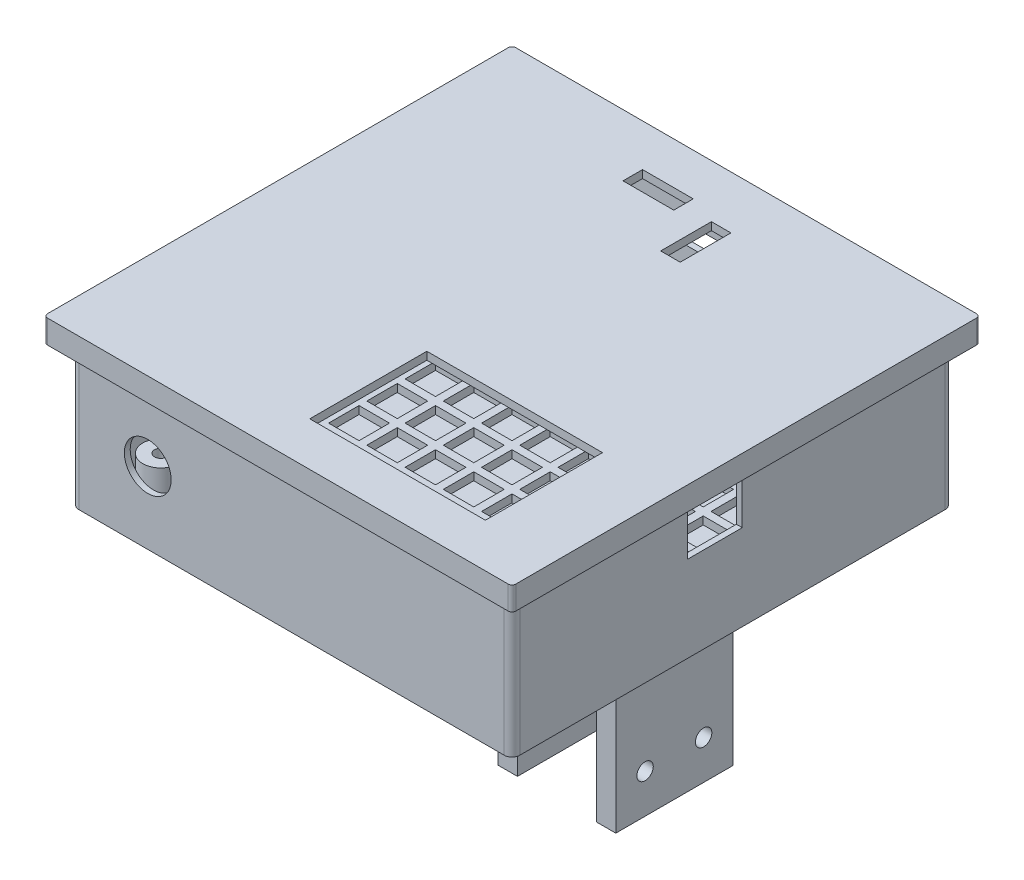
from build123d import *

# Parameters (mm, degrees)
SKETCH1_W                                    = 110
SKETCH1_H                                    = 110
BOSS_EXTRUDE1_DEPTH                          = 1.5
SKETCH2_R                                    = 1.6
CUT_EXTRUDE1_DEPTH                           = 1.5
BOSS_EXTRUDE2_START                          = 10
SKETCH4_R                                    = 4.6
SKETCH4_R_2                                  = 1.6
BOSS_EXTRUDE2_DEPTH                          = 10
MIRROR1_START                                = 10
MIRROR1_AT_THE_SECOND_PLANE_COPY_1_SKETC_R   = 4.6
MIRROR1_AT_THE_SECOND_PLANE_COPY_1_SKETC_R_2 = 1.6
MIRROR1_AT_THE_SECOND_PLANE_COPY_1_DEPTH     = 10
CUT_EXTRUDE2_DEPTH                           = 2.5
MIRROR2_AT_THE_SECOND_PLANE_COPY_1_DEPTH     = 2.5
SKETCH1_3_W                                  = 113
SKETCH1_3_H                                  = 113
SKETCH1_3_W_2                                = 110
SKETCH1_3_H_2                                = 110
BOSS_EXTRUDE3_DEPTH                          = 40
SKETCH8_R                                    = 6
CUT_EXTRUDE4_DEPTH                           = 2
SKETCH10_W                                   = 35
SKETCH10_H                                   = 5
CUT_EXTRUDE6_DEPTH                           = 2
SKETCH12_W                                   = 14
SKETCH12_H                                   = 15
CUT_EXTRUDE8_DEPTH                           = 2
SKETCH13_W                                   = 5
SKETCH13_H                                   = 30
BOSS_EXTRUDE4_DEPTH                          = 71
SKETCH14_R                                   = 2.1
CUT_EXTRUDE9_DEPTH                           = 35
RIB3_DEPTH                                   = 2.5
MIRROR3_AT_THE_SECOND_PLANE_COPY_1_DEPTH     = 2.5
SKETCH21_W                                   = 2
SKETCH21_H                                   = 110
BOSS_EXTRUDE5_DEPTH                          = 2
SKETCH22_W                                   = 110
SKETCH22_H                                   = 2
BOSS_EXTRUDE6_DEPTH                          = 2
SKETCH24_W                                   = 120
SKETCH24_H                                   = 120
BOSS_EXTRUDE7_DEPTH                          = 2
SKETCH26_W                                   = 120
SKETCH26_H                                   = 120
SKETCH26_W_2                                 = 116
SKETCH26_H_2                                 = 116
BOSS_EXTRUDE8_DEPTH                          = 4
SKETCH32_W                                   = 13
SKETCH32_H                                   = 5
SKETCH32_W_2                                 = 5
SKETCH32_H_2                                 = 13
SKETCH32_W_3                                 = 45
SKETCH32_H_3                                 = 30
CUT_EXTRUDE12_DEPTH                          = 2
FILLET1_R                                    = 1
FILLET2_R                                    = 2
CHAMFER1_SIZE                                = 5


# Read off the part's stored shape, not the designer's step: Rib3
with BuildPart() as part:
    # Sketch1 → Boss-Extrude1 (new body)
    with BuildSketch(Plane(origin=(0, 0, 0), x_dir=(1, 0, 0), z_dir=(0, 1, 0))):
        Rectangle(SKETCH1_W, SKETCH1_H)
    extrude(amount=BOSS_EXTRUDE1_DEPTH)

    # Sketch2 → Cut-Extrude1 (cut)
    with BuildSketch(Plane(origin=(0, 1.5, 0), x_dir=(1, 0, 0), z_dir=(0, 1, 0))):
        with Locations(Location((-45, 45, 0), (0, 0, 270))):
            Circle(SKETCH2_R)
        with Locations(Location((45, 45, 0), (0, 0, 270))):
            Circle(SKETCH2_R)
        with Locations(Location((45, -45, 0), (0, 0, 270))):
            Circle(SKETCH2_R)
        with Locations(Location((-45, -45, 0), (0, 0, 270))):
            Circle(SKETCH2_R)
    extrude(amount=-CUT_EXTRUDE1_DEPTH, mode=Mode.SUBTRACT)

    # Sketch4 → Boss-Extrude2 (add)
    with BuildSketch(Plane(origin=(0, 1.5, 0), x_dir=(1, 0, 0), z_dir=(0, 1, 0)).offset(BOSS_EXTRUDE2_START)):
        with Locations(Location((-45, 45, 0), (0, 0, 90))):
            Circle(SKETCH4_R)
        with Locations(Location((-45, 45, 0), (0, 0, 270))):
            Circle(SKETCH4_R_2, mode=Mode.SUBTRACT)
    boss_extrude2 = extrude(amount=-BOSS_EXTRUDE2_DEPTH)

    # Mirror1: Boss-Extrude2 across plane
    add(boss_extrude2.mirror(Plane(origin=(0, 0, 0), x_dir=(0, 0, 1), z_dir=(1, 0, 0))))

    # Mirror1 at the second plane: Boss-Extrude2 across plane
    add(boss_extrude2.mirror(Plane.XY))

    # Mirror1 at the second plane copy 1 sketc → Mirror1 at the second plane copy 1 (add)
    with BuildSketch(Plane(origin=(0, 1.5, 0), x_dir=(-1, 0, 0), z_dir=(0, 1, 0)).offset(MIRROR1_START)):
        with Locations(Location((-45, 45, 0), (0, 0, 90))):
            Circle(MIRROR1_AT_THE_SECOND_PLANE_COPY_1_SKETC_R)
        with Locations(Location((-45, 45, 0), (0, 0, 270))):
            Circle(MIRROR1_AT_THE_SECOND_PLANE_COPY_1_SKETC_R_2, mode=Mode.SUBTRACT)
    extrude(amount=-MIRROR1_AT_THE_SECOND_PLANE_COPY_1_DEPTH)

    # Sketch5 → Cut-Extrude2 (cut)
    with BuildSketch(Plane.XZ):
        Polygon((45, 41.535898385), (48, 43.267949192), (48, 46.732050808), (45, 48.464101615), (42, 46.732050808), (42, 43.267949192), align=None)
    cut_extrude2 = extrude(amount=-CUT_EXTRUDE2_DEPTH, mode=Mode.SUBTRACT)

    # Mirror2: Cut-Extrude2 across plane
    add(cut_extrude2.mirror(Plane.XY), mode=Mode.SUBTRACT)

    # Mirror2 at the second plane: Cut-Extrude2 across plane
    add(cut_extrude2.mirror(Plane(origin=(0, 0, 0), x_dir=(0, 0, 1), z_dir=(1, 0, 0))), mode=Mode.SUBTRACT)

    # Mirror2 at the second plane copy 1 sketc → Mirror2 at the second plane copy 1 (cut)
    with BuildSketch(Plane(origin=(0, 0, 0), x_dir=(-1, 0, 0), z_dir=(0, -1, 0))):
        Polygon((45, 41.535898385), (48, 43.267949192), (48, 46.732050808), (45, 48.464101615), (42, 46.732050808), (42, 43.267949192), align=None)
    extrude(amount=-MIRROR2_AT_THE_SECOND_PLANE_COPY_1_DEPTH, mode=Mode.SUBTRACT)

    # Sketch1<3> → Boss-Extrude3 (add)
    with BuildSketch(Plane(origin=(0, 0, 0), x_dir=(1, 0, 0), z_dir=(0, 1, 0))):
        Rectangle(SKETCH1_3_W, SKETCH1_3_H)
        Rectangle(SKETCH1_3_W_2, SKETCH1_3_H_2, mode=Mode.SUBTRACT)
    extrude(amount=BOSS_EXTRUDE3_DEPTH)

    # Sketch8 → Cut-Extrude4 (cut)
    with BuildSketch(Plane.XY.offset(56.5)):
        with Locations((-36.83747895, 18.426638166)):
            Circle(SKETCH8_R)
    extrude(amount=-CUT_EXTRUDE4_DEPTH, mode=Mode.SUBTRACT)

    # Sketch10 → Cut-Extrude6 (cut)
    with BuildSketch(Plane(origin=(0, 0, -56.5), x_dir=(-1, 0, 0), z_dir=(0, 0, -1))):
        with Locations((1, 27.5)):
            Rectangle(SKETCH10_W, SKETCH10_H)
    extrude(amount=-CUT_EXTRUDE6_DEPTH, mode=Mode.SUBTRACT)

    # Sketch12 → Cut-Extrude8 (cut)
    with BuildSketch(Plane(origin=(56.5, 0, 0), x_dir=(0, 0, -1), z_dir=(1, 0, 0))):
        with Locations((-4.5, 29.5)):
            Rectangle(SKETCH12_W, SKETCH12_H)
    extrude(amount=-CUT_EXTRUDE8_DEPTH, mode=Mode.SUBTRACT)

    # Sketch13 → Boss-Extrude4 (add)
    with BuildSketch(Plane.XZ):
        with Locations((-12.6, -26.5)):
            Rectangle(SKETCH13_W, SKETCH13_H)
        with Locations((12.6, -26.5)):
            Rectangle(SKETCH13_W, SKETCH13_H)
    extrude(amount=BOSS_EXTRUDE4_DEPTH)

    # Sketch14 → Cut-Extrude9 (cut)
    with BuildSketch(Plane(origin=(15.1, 0, 0), x_dir=(0, 0, -1), z_dir=(1, 0, 0))):
        with Locations((19, -61)):
            Circle(SKETCH14_R)
        with Locations((34, -61)):
            Circle(SKETCH14_R)
    extrude(amount=-CUT_EXTRUDE9_DEPTH, mode=Mode.SUBTRACT)

    # Rib3 outline → Rib3 (add)
    with BuildSketch(Plane(origin=(0, 35, 0), x_dir=(1, 0, 0), z_dir=(0, 1, 0))):
        Polygon((-49, -55), (-55, -49), (-55, -55), align=None)
    rib3 = extrude(amount=RIB3_DEPTH)

    # Mirror3: Rib3 across plane
    add(rib3.mirror(Plane(origin=(0, 0, 0), x_dir=(0, 0, 1), z_dir=(1, 0, 0))))

    # Mirror3 at the second plane: Rib3 across plane
    add(rib3.mirror(Plane.XY))

    # Mirror3 at the second plane copy 1 sketc → Mirror3 at the second plane copy 1 (add)
    with BuildSketch(Plane(origin=(0, 35, 0), x_dir=(-1, 0, 0), z_dir=(0, 1, 0))):
        Polygon((-49, -55), (-55, -49), (-55, -55), align=None)
    extrude(amount=MIRROR3_AT_THE_SECOND_PLANE_COPY_1_DEPTH)

    # Sketch21 → Boss-Extrude5 (add)
    with BuildSketch(Plane(origin=(0, 1.5, 0), x_dir=(1, 0, 0), z_dir=(0, 1, 0))):
        Rectangle(SKETCH21_W, SKETCH21_H)
        with Locations((9.8, 0)):
            Rectangle(SKETCH21_W, SKETCH21_H)
        with Locations((19.6, 0)):
            Rectangle(SKETCH21_W, SKETCH21_H)
        with Locations((29.4, 0)):
            Rectangle(SKETCH21_W, SKETCH21_H)
        with Locations((39.2, 0)):
            Rectangle(SKETCH21_W, SKETCH21_H)
        with Locations((49, 0)):
            Rectangle(SKETCH21_W, SKETCH21_H)
        with Locations((-49, 0)):
            Rectangle(SKETCH21_W, SKETCH21_H)
        with Locations((-39.2, 0)):
            Rectangle(SKETCH21_W, SKETCH21_H)
        with Locations((-29.4, 0)):
            Rectangle(SKETCH21_W, SKETCH21_H)
        with Locations((-19.6, 0)):
            Rectangle(SKETCH21_W, SKETCH21_H)
        with Locations((-9.8, 0)):
            Rectangle(SKETCH21_W, SKETCH21_H)
    extrude(amount=BOSS_EXTRUDE5_DEPTH)

    # Sketch22 → Boss-Extrude6 (add)
    with BuildSketch(Plane(origin=(0, 1.5, 0), x_dir=(1, 0, 0), z_dir=(0, 1, 0))):
        Rectangle(SKETCH22_W, SKETCH22_H)
        with Locations((0, 9.8)):
            Rectangle(SKETCH22_W, SKETCH22_H)
        with Locations((0, 19.6)):
            Rectangle(SKETCH22_W, SKETCH22_H)
        with Locations((0, 29.4)):
            Rectangle(SKETCH22_W, SKETCH22_H)
        with Locations((0, 39.2)):
            Rectangle(SKETCH22_W, SKETCH22_H)
        with Locations((0, 49)):
            Rectangle(SKETCH22_W, SKETCH22_H)
        with Locations((0, -49)):
            Rectangle(SKETCH22_W, SKETCH22_H)
        with Locations((0, -39.2)):
            Rectangle(SKETCH22_W, SKETCH22_H)
        with Locations((0, -29.4)):
            Rectangle(SKETCH22_W, SKETCH22_H)
        with Locations((0, -19.6)):
            Rectangle(SKETCH22_W, SKETCH22_H)
        with Locations((0, -9.8)):
            Rectangle(SKETCH22_W, SKETCH22_H)
    extrude(amount=BOSS_EXTRUDE6_DEPTH)

    # Fillet2
    fillet2_edges = [part.edges().sort_by_distance(p)[0] for p in [
        (55, 38.75, -55),
        (-55, 38.75, 55),
        (-55, 38.75, -55),
        (55, 38.75, 55),
        (-56.5, 20, -56.5),
        (-56.5, 20, 56.5),
        (56.5, 20, 56.5),
        (56.5, 20, -56.5),
        (-55, 18.25, 55),
        (-55, 18.25, -55),
        (55, 18.25, 55),
        (55, 18.25, -55),
    ]]
    fillet(fillet2_edges, radius=FILLET2_R)

    # Chamfer1
    chamfer1_edges = [part.edges().sort_by_distance(p)[0] for p in [
        (-10.1, 0, -26.5),
        (-12.6, 0, -11.5),
        (-15.1, 0, -26.5),
        (-12.6, 0, -41.5),
        (15.1, 0, -26.5),
        (12.6, 0, -11.5),
        (10.1, 0, -26.5),
        (12.6, 0, -41.5),
    ]]
    chamfer(chamfer1_edges, length=CHAMFER1_SIZE)


with BuildPart() as body_2:
    # Sketch24 → Boss-Extrude7 (new body)
    with BuildSketch(Plane(origin=(0, 40, 0), x_dir=(1, 0, 0), z_dir=(0, 1, 0))):
        Rectangle(SKETCH24_W, SKETCH24_H)
    extrude(amount=BOSS_EXTRUDE7_DEPTH)


with BuildPart() as body_3:
    # Sketch26 → Boss-Extrude8 (new body)
    with BuildSketch(Plane.XZ.offset(-40)):
        Rectangle(SKETCH26_W, SKETCH26_H)
        Rectangle(SKETCH26_W_2, SKETCH26_H_2, mode=Mode.SUBTRACT)
    extrude(amount=BOSS_EXTRUDE8_DEPTH)

    # Combine1: union body 2
    add(body_2.part)

    # Sketch32 → Cut-Extrude12 (cut)
    with BuildSketch(Plane(origin=(0, 42, 0), x_dir=(1, 0, 0), z_dir=(0, 1, 0))):
        with Locations((-9.24, 46.69)):
            Rectangle(SKETCH32_W, SKETCH32_H)
        with Locations((7.14, 39.96)):
            Rectangle(SKETCH32_W_2, SKETCH32_H_2)
        with Locations((19.44, -33.76)):
            Rectangle(SKETCH32_W_3, SKETCH32_H_3)
    extrude(amount=-CUT_EXTRUDE12_DEPTH, mode=Mode.SUBTRACT)

    # Fillet1
    fillet1_edges = [body_3.edges().sort_by_distance(p)[0] for p in [
        (58, 38, 58),
        (-58, 38, 58),
        (-58, 38, -58),
        (58, 38, -58),
        (-60, 39, -60),
        (-60, 39, 60),
        (60, 39, 60),
        (60, 39, -60),
    ]]
    fillet(fillet1_edges, radius=FILLET1_R)


solid = Compound([part.part, body_3.part])
